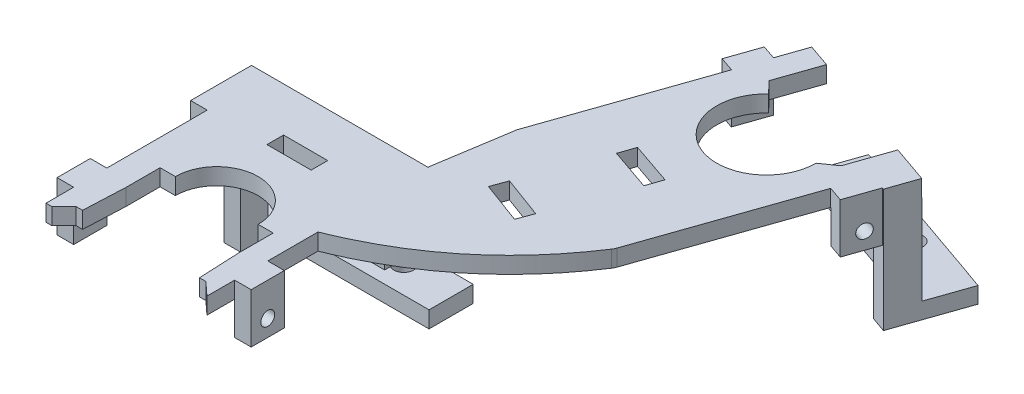
from build123d import *

# Parameters (mm, degrees)
SKETCH1_W                 = 29.13
SKETCH1_H                 = 40.2
BOSS_EXTRUDE1_DEPTH       = 3
SKETCH3_W                 = 6
SKETCH3_H                 = 3
BOSS_EXTRUDE2_DEPTH       = 3
SKETCH4_W                 = 3
SKETCH4_H                 = 6
BOSS_EXTRUDE3_DEPTH       = 6
SKETCH6_W                 = 6
SKETCH6_H                 = 3
BOSS_EXTRUDE4_DEPTH       = 2
SKETCH7_W                 = 3.000000005
SKETCH7_H                 = 6
BOSS_EXTRUDE6_DEPTH       = 6
SKETCH9_R                 = 1.25
CUT_EXTRUDE1_DEPTH        = 3
SKETCH8_R                 = 1.250000001
CUT_EXTRUDE2_DEPTH        = 3
SKETCH11_W                = 6
SKETCH11_H                = 3
BOSS_EXTRUDE7_DEPTH       = 3
SKETCH19_W                = 3
SKETCH19_H                = 6
BOSS_EXTRUDE11_DEPTH      = 6
SKETCH21_W                = 6
SKETCH21_H                = 3
BOSS_EXTRUDE12_DEPTH      = 3
SKETCH22_W                = 3
SKETCH22_H                = 6
BOSS_EXTRUDE13_DEPTH      = 6
SKETCH24_R                = 1.25
CUT_EXTRUDE5_DEPTH        = 4
SKETCH23_R                = 1.25
CUT_EXTRUDE6_DEPTH        = 4
CUT_EXTRUDE11_DEPTH       = 4
SKETCH30_W                = 25.92
SKETCH30_H                = 3
CUT_EXTRUDE12_DEPTH       = 15
SKETCH33_W                = 29.17650364
SKETCH33_H                = 3
BOSS_EXTRUDE14_DEPTH      = 40.3
SKETCH34_W                = 21.00258235
SKETCH34_H                = 3
CUT_EXTRUDE15_DEPTH       = 25
SKETCH37_W                = 4.5
SKETCH37_H                = 3
SKETCH37_W_2              = 1.5
BOSS_EXTRUDE15_DEPTH      = 3
BOSS_EXTRUDE16_DEPTH      = 6
SKETCH41_W                = 6
SKETCH41_H                = 3
BOSS_EXTRUDE17_DEPTH      = 2.8
BOSS_EXTRUDE18_DEPTH      = 6
SKETCH46_W                = 5.02
SKETCH46_H                = 3
BOSS_EXTRUDE19_DEPTH      = 3
SKETCH48_W                = 3
SKETCH48_H                = 5.02
BOSS_EXTRUDE20_DEPTH      = 22.25
BOSS_EXTRUDE22_DEPTH      = 29.13
BOSS_EXTRUDE22_DEPTH_BACK = 3
SKETCH50_W                = 8
SKETCH50_H                = 3
SKETCH51_R                = 1.75
CUT_EXTRUDE21_DEPTH       = 5
SKETCH56_W                = 3.994197227
SKETCH56_H                = 3.994197227
CUT_EXTRUDE26_DEPTH       = 0.1
FILLET4_START             = -19
FILLET4_DEPTH             = 5
BOSS_EXTRUDE28_DEPTH      = 0.21
BOSS_EXTRUDE29_DEPTH      = 3
BOSS_EXTRUDE30_DEPTH      = 1.95
BOSS_EXTRUDE30_DEPTH_BACK = 4
SKETCH68_W                = 4.32399603
SKETCH68_H                = 3
SKETCH69_W                = 3.919724064
SKETCH69_H                = 3
BOSS_EXTRUDE31_DEPTH      = 1.83
SKETCH70_W                = 5.44243662
SKETCH70_H                = 3
BOSS_EXTRUDE32_DEPTH      = 3.1
BOSS_EXTRUDE33_DEPTH      = 19.18
SKETCH72_W                = 2.9
SKETCH72_H                = 2.93342148
BOSS_EXTRUDE34_DEPTH      = 8
SKETCH73_W                = 8
SKETCH73_H                = 2.93342148
BOSS_EXTRUDE35_DEPTH      = 29.31
SKETCH74_R                = 1.749999995
CUT_EXTRUDE27_DEPTH       = 5
SKETCH75_R                = 1.25
CUT_EXTRUDE28_DEPTH       = 5
SKETCH76_R                = 1.25
CUT_EXTRUDE29_DEPTH       = 5
BOSS_EXTRUDE37_DEPTH      = 3
BOSS_EXTRUDE40_DEPTH      = 3
SKETCH79_W                = 4
SKETCH79_H                = 3
CUT_EXTRUDE30_DEPTH       = 10
CUT_EXTRUDE31_DEPTH       = 10
CUT_EXTRUDE32_DEPTH       = 10


with BuildPart() as part:
    # Sketch1 → Boss-Extrude1 (new body)
    with BuildSketch(Plane(origin=(0, 0, 0), x_dir=(1, 0, 0), z_dir=(0, 1, 0))):
        with Locations((-32.231128585, -983.966354464)):
            Rectangle(SKETCH1_W, SKETCH1_H)
        with BuildLine():
            Line((-15.507778999, -950.239071497), (-17.666128585, -963.866354464))
            Line((-17.666128585, -963.866354464), (-17.666128585, -983.966354464))
            add(Edge.make_bspline(
                [(11.825950039, -959.709415703), (1.028086592, -976.494542347), (-17.666128585, -983.966354464)],
                knots=[0, 0, 0, 1, 1, 1], degree=2))
            Line((11.825950039, -959.709415703), (-15.497121464, -950.208422428))
            Line((-15.497121464, -950.208422428), (-15.507778999, -950.239071497))
        make_face()
    extrude(amount=-BOSS_EXTRUDE1_DEPTH)

    # Sketch3 → Boss-Extrude2 (add)
    with BuildSketch(Plane.ZY.offset(46.796128585)):
        with Locations((971.886354464, -1.5)):
            Rectangle(SKETCH3_W, SKETCH3_H)
    extrude(amount=BOSS_EXTRUDE2_DEPTH)

    # Sketch4 → Boss-Extrude3 (add)
    with BuildSketch(Plane.XZ.offset(3)):
        with Locations((-48.296128585, 971.886354464)):
            Rectangle(SKETCH4_W, SKETCH4_H)
    extrude(amount=BOSS_EXTRUDE3_DEPTH)

    # Sketch6 → Boss-Extrude4 (add)
    with BuildSketch(Plane(origin=(-17.666128585, 0, 0), x_dir=(0, 0, -1), z_dir=(1, 0, 0))):
        with Locations((-971.886354464, -1.5)):
            Rectangle(SKETCH6_W, SKETCH6_H)
    extrude(amount=BOSS_EXTRUDE4_DEPTH)

    # Sketch7 → Boss-Extrude6 (add)
    with BuildSketch(Plane.XZ.offset(3)):
        with Locations((-16.166128583, 971.886354464)):
            Rectangle(SKETCH7_W, SKETCH7_H)
    extrude(amount=BOSS_EXTRUDE6_DEPTH)

    # Sketch9 → Cut-Extrude1 (cut)
    with BuildSketch(Plane.ZY.offset(17.666128585)):
        with Locations((972.066354464, -6)):
            Circle(SKETCH9_R)
    extrude(amount=-CUT_EXTRUDE1_DEPTH, mode=Mode.SUBTRACT)

    # Sketch8 → Cut-Extrude2 (cut)
    with BuildSketch(Plane(origin=(-49.796128585, 0, 0), x_dir=(0, 0, -1), z_dir=(1, 0, 0))):
        with Locations(Location((-972.066168305, -5.999675203, 0), (0, 0, 180))):
            Circle(SKETCH8_R)
    extrude(amount=CUT_EXTRUDE2_DEPTH, mode=Mode.SUBTRACT)

    # Sketch11 → Boss-Extrude7 (add)
    with BuildSketch(Plane.ZY.offset(46.796128585)):
        with Locations((996.056354464, -1.5)):
            Rectangle(SKETCH11_W, SKETCH11_H)
    extrude(amount=BOSS_EXTRUDE7_DEPTH)

    # Sketch19 → Boss-Extrude11 (add)
    with BuildSketch(Plane.XZ.offset(3)):
        with Locations((-48.296128585, 996.056354464)):
            Rectangle(SKETCH19_W, SKETCH19_H)
    extrude(amount=BOSS_EXTRUDE11_DEPTH)

    # Sketch21 → Boss-Extrude12 (add)
    with BuildSketch(Plane(origin=(-17.666128585, 0, 0), x_dir=(0, 0, -1), z_dir=(1, 0, 0))):
        with Locations((-996.056354464, -1.5)):
            Rectangle(SKETCH21_W, SKETCH21_H)
    extrude(amount=BOSS_EXTRUDE12_DEPTH)

    # Sketch22 → Boss-Extrude13 (add)
    with BuildSketch(Plane.XZ.offset(3)):
        with Locations((-16.166128585, 996.056354464)):
            Rectangle(SKETCH22_W, SKETCH22_H)
    extrude(amount=BOSS_EXTRUDE13_DEPTH)

    # Sketch24 → Cut-Extrude5 (cut)
    with BuildSketch(Plane(origin=(-46.796128585, 0, 0), x_dir=(0, 0, -1), z_dir=(1, 0, 0))):
        with Locations((-996.058375158, -6)):
            Circle(SKETCH24_R)
    extrude(amount=-CUT_EXTRUDE5_DEPTH, mode=Mode.SUBTRACT)

    # Sketch23 → Cut-Extrude6 (cut)
    with BuildSketch(Plane.ZY.offset(17.666128585)):
        with Locations((996.058154464, -6)):
            Circle(SKETCH23_R)
    extrude(amount=-CUT_EXTRUDE6_DEPTH, mode=Mode.SUBTRACT)

    # Sketch29 → Cut-Extrude11 (cut)
    with BuildSketch(Plane(origin=(0, 0, 0), x_dir=(1, 0, 0), z_dir=(0, 1, 0))):
        Polygon((-24.326128585, -988.183184315), (-24.326128585, -1004.066354464), (-17.666128585, -1004.066354464), (-20.056128585, -1001.868057312), (-21.216128585, -1001.868057312), (-21.426128585, -997.305136389), (-21.556128585, -994.347976596), (-21.556128585, -988.183184315), align=None)
        Polygon((-42.032837695, -988.183184315), (-39.266128585, -988.183184315), (-39.266128585, -1004.066354464), (-45.730771266, -1004.066354464), (-43.532474114, -1001.868057312), (-42.376382193, -1001.868057312), (-42.032837695, -994.347976596), align=None)
    extrude(amount=-CUT_EXTRUDE11_DEPTH, mode=Mode.SUBTRACT)

    # Sketch30 → Cut-Extrude12 (cut)
    with BuildSketch(Plane.ZY.offset(39.266128585)):
        with Locations((991.106354464, -1.5)):
            Rectangle(SKETCH30_W, SKETCH30_H)
    extrude(amount=-CUT_EXTRUDE12_DEPTH, mode=Mode.SUBTRACT)

    # Sketch33 → Boss-Extrude14 (add)
    with BuildSketch(Plane(origin=(-296.443416752, 0, 852.515567448), x_dir=(-0.9445255798324886, 0, -0.32843786176703366), z_dir=(0.3284378617670337, 0, -0.9445255798324887))):
        with Locations((-311.77524668, -1.5)):
            Rectangle(SKETCH33_W, SKETCH33_H)
    extrude(amount=BOSS_EXTRUDE14_DEPTH)

    # Sketch34 → Cut-Extrude15 (cut)
    with BuildSketch(Plane(origin=(-283.207370923, 0, 814.451186581), x_dir=(-0.9445255798324887, 0, -0.32843786176703327), z_dir=(0.32843786176703327, 0, -0.9445255798324887))):
        with Locations((-311.942483261, -1.5)):
            Rectangle(SKETCH34_W, SKETCH34_H)
    extrude(amount=-CUT_EXTRUDE15_DEPTH, mode=Mode.SUBTRACT)

    # Sketch37 → Boss-Extrude15 (add)
    with BuildSketch(Plane(origin=(280.946295288, 0, 97.69285498), x_dir=(-0.32843786176743117, 0, 0.9445255798323505), z_dir=(-0.9445255798323505, 0, -0.32843786176743117))):
        with Locations((868.136002588, -1.5)):
            Rectangle(SKETCH37_W, SKETCH37_H)
        with Locations((871.136002588, -1.5)):
            Rectangle(SKETCH37_W_2, SKETCH37_H)
    extrude(amount=BOSS_EXTRUDE15_DEPTH)

    # Sketch39 → Boss-Extrude16 (add)
    with BuildSketch(Plane.XZ.offset(3)):
        Polygon((-6.277028676, 914.559020058), (-3.745700122, 915.439233528), (-5.716327292, 921.106387007), (-8.247655846, 920.226173537), align=None)
    extrude(amount=BOSS_EXTRUDE16_DEPTH)

    # Sketch41 → Boss-Extrude17 (add)
    with BuildSketch(Plane(origin=(308.258672657, 0, 107.190129606), x_dir=(0.3284378617670337, 0, -0.9445255798324887), z_dir=(0.9445255798324887, 0, 0.3284378617670337))):
        with Locations((-868.898439213, -1.5)):
            Rectangle(SKETCH41_W, SKETCH41_H)
    extrude(amount=BOSS_EXTRUDE17_DEPTH)

    # Sketch42 → Boss-Extrude18 (add)
    with BuildSketch(Plane.XZ.offset(3)):
        Polygon((23.893176542, 925.063208116), (21.922549371, 930.730361595), (24.538885227, 931.640134472), (26.509512398, 925.972980993), align=None)
    extrude(amount=BOSS_EXTRUDE18_DEPTH)


with BuildPart() as body_2:
    # Mirror1: mirrored copy
    add(part.part.mirror(Plane(origin=(0, -9, 0), x_dir=(0, 0, 1), z_dir=(0, -1, 0))))

    # Sketch46 → Boss-Extrude19 (add)
    with BuildSketch(Plane.ZY.offset(46.796128585)):
        with Locations((966.376354464, -16.5)):
            Rectangle(SKETCH46_W, SKETCH46_H)
    extrude(amount=BOSS_EXTRUDE19_DEPTH)

    # Sketch48 → Boss-Extrude20 (add)
    with BuildSketch(Plane(origin=(0, -15, 0), x_dir=(1, 0, 0), z_dir=(0, 1, 0))):
        with Locations((-48.296128585, -966.376354464)):
            Rectangle(SKETCH48_W, SKETCH48_H)
    extrude(amount=BOSS_EXTRUDE20_DEPTH)

    # Sketch50 → Boss-Extrude22 (add, two sides: drawn at the far end of the back side and taken through both)
    with BuildSketch(Plane(origin=(-46.796128585, 0, 0), x_dir=(0, 0, -1), z_dir=(1, 0, 0)).offset(-BOSS_EXTRUDE22_DEPTH_BACK)):
        with Locations((-959.866354464, 5.75)):
            Rectangle(SKETCH50_W, SKETCH50_H)
    extrude(amount=BOSS_EXTRUDE22_DEPTH + BOSS_EXTRUDE22_DEPTH_BACK)

    # Sketch51 → Cut-Extrude21 (cut)
    with BuildSketch(Plane(origin=(0, 7.25, 0), x_dir=(1, 0, 0), z_dir=(0, 1, 0))):
        with Locations(Location((-37.391128585, -959.066354477, 0), (0, 0, 270))):
            Circle(SKETCH51_R)
        with Locations(Location((-27.041128585, -959.066354477, 0), (0, 0, 270))):
            Circle(SKETCH51_R)
    extrude(amount=-CUT_EXTRUDE21_DEPTH, mode=Mode.SUBTRACT)

    # Sketch56 → Cut-Extrude26 (cut)
    with BuildSketch(Plane(origin=(-283.207370923, 0, 814.451186581), x_dir=(-0.9445255798324892, 0, -0.32843786176703227), z_dir=(0.32843786176703227, 0, -0.9445255798324892))):
        with Locations((-299.444093473, -16.997098614)):
            Rectangle(SKETCH56_W, SKETCH56_H)
    extrude(amount=-CUT_EXTRUDE26_DEPTH, mode=Mode.SUBTRACT)

    # Fillet4: read off the stored shape, not the designer's step
    # Fillet4 outline → Fillet4 (cut)
    with BuildSketch(Plane(origin=(0, 0, 0), x_dir=(1, 0, 0), z_dir=(0, 1, 0)).offset(FILLET4_START)):
        with BuildLine():
            Line((11.815255904, -959.705697054), (11.918892326, -959.407658179))
            ThreePointArc((11.918892326, -959.407658179), (11.77847749, -959.744040081), (11.598302874, -960.060909482))
            add(Edge.make_bspline(
                [(11.825950039, -959.709415703), (11.712561825, -959.885676085), (11.598302874, -960.060909482)],
                knots=[0, 0, 0, 0.010500986, 0.010500986, 0.010500986], degree=2))
            Line((11.825950039, -959.709415703), (11.815255904, -959.705697054))
        make_face()
    extrude(amount=FILLET4_DEPTH, mode=Mode.SUBTRACT)


with BuildPart() as body_2_2:
    # Mirror2: mirrored copy
    add(body_2.part.mirror(Plane(origin=(-13.409558554, -18, 961.997167091), x_dir=(0, 0, 1), z_dir=(0, -1, 0))))

    # Sketch63 → Boss-Extrude28 (add)
    with BuildSketch(Plane(origin=(131.691734271, 0, 20.857921628), x_dir=(-0.15643446504022615, 0, 0.9876883405951385), z_dir=(-0.9876883405951385, 0, -0.15643446504022615))):
        with BuildLine():
            add(Edge.make_bspline(
                [(954.763151571, -21), (947.864577189, -21), (940.966002807, -21)],
                knots=[0, 0, 0, 1, 1, 1], degree=2))
            Line((940.966002807, -21), (940.966002807, -18))
            add(Edge.make_bspline(
                [(954.763151571, -18), (947.864577189, -18), (940.966002807, -18)],
                knots=[0, 0, 0, 1, 1, 1], degree=2))
            Line((954.763151571, -18), (954.763151571, -21))
        make_face()
    extrude(amount=BOSS_EXTRUDE28_DEPTH)

    # Sketch67 → Boss-Extrude29 (add)
    with BuildSketch(Plane(origin=(0, -18, 0), x_dir=(1, 0, 0), z_dir=(0, 1, 0))):
        Polygon((-15.715193551, -950.206220259), (-15.742698114, -950.123028585), (-15.497121464, -950.208422428), (-15.507778999, -950.239071497), align=None)
    extrude(amount=-BOSS_EXTRUDE29_DEPTH)

    # Sketch68 → Boss-Extrude30 (add, two sides: drawn at the far end of the back side and taken through both)
    with BuildSketch(Plane(origin=(-283.240214709, 0, 814.545639139), x_dir=(-0.9445255798324883, -3.1744861168227707e-15, -0.32843786176703493), z_dir=(0.32843786176703493, -9.129225613729643e-15, -0.9445255798324883)).offset(-BOSS_EXTRUDE30_DEPTH_BACK)):
        with Locations((-299.279194071, -19.5)):
            Rectangle(SKETCH68_W, SKETCH68_H)
    extrude(amount=BOSS_EXTRUDE30_DEPTH + BOSS_EXTRUDE30_DEPTH_BACK)

    # Sketch69 → Boss-Extrude31 (add)
    with BuildSketch(Plane(origin=(-283.207370923, 0, 814.451186581), x_dir=(-0.9445255798324895, 0, -0.32843786176703144), z_dir=(0.32843786176703144, 0, -0.9445255798324895))):
        with Locations((-324.403636468, -19.5)):
            Rectangle(SKETCH69_W, SKETCH69_H)
    extrude(amount=BOSS_EXTRUDE31_DEPTH)

    # Sketch70 → Boss-Extrude32 (add)
    with BuildSketch(Plane(origin=(308.258672657, 0, 107.190129606), x_dir=(0.3284378617670337, 0, -0.9445255798324887), z_dir=(0.9445255798324887, 0, 0.3284378617670337))):
        with Locations((-863.177220903, -19.5)):
            Rectangle(SKETCH70_W, SKETCH70_H)
    extrude(amount=BOSS_EXTRUDE32_DEPTH)

    # Sketch71 → Boss-Extrude33 (add)
    with BuildSketch(Plane.XZ.offset(21)):
        Polygon((28.589002033, 920.906174309), (26.792870072, 926.071512351), (24.05374589, 925.119042552), (25.841248137, 919.978521948), align=None)
    extrude(amount=BOSS_EXTRUDE33_DEPTH)

    # Sketch72 → Boss-Extrude34 (add)
    with BuildSketch(Plane(origin=(-282.606329636, 0, 812.722704769), x_dir=(-0.9445255798324861, 0, -0.3284378617670412), z_dir=(0.3284378617670412, 0, -0.9445255798324861))):
        with Locations((-328.0134985, -38.71328926)):
            Rectangle(SKETCH72_W, SKETCH72_H)
    extrude(amount=BOSS_EXTRUDE34_DEPTH)

    # Sketch73 → Boss-Extrude35 (add)
    with BuildSketch(Plane(origin=(308.447577773, 0, 107.255817179), x_dir=(-0.32843786176702733, 0, 0.9445255798324909), z_dir=(-0.944525579832491, 0, -0.32843786176702733))):
        with Locations((856.429727564, -38.71328926)):
            Rectangle(SKETCH73_W, SKETCH73_H)
    extrude(amount=BOSS_EXTRUDE35_DEPTH)

    # Sketch74 → Cut-Extrude27 (cut)
    with BuildSketch(Plane.XZ.offset(40.18)):
        with Locations(Location((18.430180878, 912.294788657, 0), (0, 0, 270))):
            Circle(SKETCH74_R)
        with Locations(Location((8.654341123, 908.895456798, 0), (0, 0, 270))):
            Circle(SKETCH74_R)
    extrude(amount=-CUT_EXTRUDE27_DEPTH, mode=Mode.SUBTRACT)


with BuildPart() as body_2_3:
    # Mirror3: mirrored copy
    add(body_2_2.part.mirror(Plane(origin=(-34.71389823, -43.25, 960.314964032), x_dir=(0, 0, 1), z_dir=(0, -1, 0))))


with BuildPart() as body_2_4:
    # Mirror4: mirrored copy
    add(body_2_3.part.mirror(Plane(origin=(-34.71389823, -43.25, 960.314964032), x_dir=(0, 0, 1), z_dir=(0, 1, 0))))

    # Sketch75 → Cut-Extrude28 (cut)
    with BuildSketch(Plane(origin=(278.112718549, 0, 96.707541395), x_dir=(-0.32843786176743106, 0, 0.9445255798323505), z_dir=(-0.9445255798323505, 0, -0.32843786176743106))):
        with Locations((868.450251665, -23.999675203)):
            Circle(SKETCH75_R)
    extrude(amount=-CUT_EXTRUDE28_DEPTH, mode=Mode.SUBTRACT)

    # Sketch76 → Cut-Extrude29 (cut)
    with BuildSketch(Plane(origin=(310.90334428, 0, 108.109755619), x_dir=(0.32843786176703343, 0, -0.9445255798324887), z_dir=(0.9445255798324889, 0, 0.3284378617670335))):
        with Locations(Location((-868.450251635, -23.999675203, 0), (0, 0, 180))):
            Circle(SKETCH76_R)
    extrude(amount=-CUT_EXTRUDE29_DEPTH, mode=Mode.SUBTRACT)

    # Sketch77 → Boss-Extrude37 (add)
    with BuildSketch(Plane(origin=(0, -18, 0), x_dir=(1, 0, 0), z_dir=(0, 1, 0))):
        with BuildLine():
            Line((1.462533805, -921.55041641), (-0.557648707, -919.406501824))
            Line((-0.557648707, -919.406501824), (-2.281492719, -924.363953307))
            Line((-2.281492719, -924.363953307), (-6.699400727, -937.069026653))
            Line((-6.699400727, -937.069026653), (11.67040627, -948.187810964))
            Line((11.67040627, -948.187810964), (16.81454968, -933.394221056))
            Line((16.81454968, -933.394221056), (19.299071834, -926.249202161))
            Line((19.299071834, -926.249202161), (16.634671795, -928.100585311))
            ThreePointArc((16.634671795, -928.100585311), (4.06740687, -936.363431126), (1.462533805, -921.55041641))
        make_face()
    extrude(amount=-BOSS_EXTRUDE37_DEPTH)

    # Sketch78 → Boss-Extrude40 (add)
    with BuildSketch(Plane(origin=(0, -18, 0), x_dir=(1, 0, 0), z_dir=(0, 1, 0))):
        with BuildLine():
            Line((-39.266128585, -978.146354464), (-39.266128585, -988.183184315))
            ThreePointArc((-39.266128585, -988.183184315), (-31.766128585, -980.683184315), (-24.266128585, -988.183184315))
            Line((-24.266128585, -988.183184315), (-24.266128585, -978.146354464))
            Line((-24.266128585, -978.146354464), (-39.266128585, -978.146354464))
        make_face()
    extrude(amount=-BOSS_EXTRUDE40_DEPTH)

    # Sketch79 → Cut-Extrude30 (cut)
    with BuildSketch(Plane(origin=(0, -18, 0), x_dir=(1, 0, 0), z_dir=(0, 1, 0))):
        with Locations((-29.982661302, -973.386354464)):
            Rectangle(SKETCH79_W, SKETCH79_H)
        with Locations((-33.982661302, -973.386354464)):
            Rectangle(SKETCH79_W, SKETCH79_H)
    extrude(amount=-CUT_EXTRUDE30_DEPTH, mode=Mode.SUBTRACT)

    # Sketch85 → Cut-Extrude31 (cut)
    with BuildSketch(Plane(origin=(0, -18, 0), x_dir=(1, 0, 0), z_dir=(0, 1, 0))):
        Polygon((-5.461858654, -962.859459909), (-4.428526542, -960.066178119), (-8.334299408, -958.621296855), (-9.36763152, -961.414578645), align=None)
        Polygon((-0.83135104, -961.396898482), (-4.428526542, -960.066178119), (-5.461858654, -962.859459909), (-1.864683152, -964.190180273), align=None)
    extrude(amount=-CUT_EXTRUDE31_DEPTH, mode=Mode.SUBTRACT)

    # Sketch82 → Cut-Extrude32 (cut)
    with BuildSketch(Plane(origin=(0, -18, 0), x_dir=(1, 0, 0), z_dir=(0, 1, 0))):
        Polygon((5.559542696, -944.376350609), (4.58381617, -947.230053718), (-2.980774937, -944.626793955), (-2.010193078, -941.788137432), align=None)
    extrude(amount=-CUT_EXTRUDE32_DEPTH, mode=Mode.SUBTRACT)


solid = body_2_4.part
